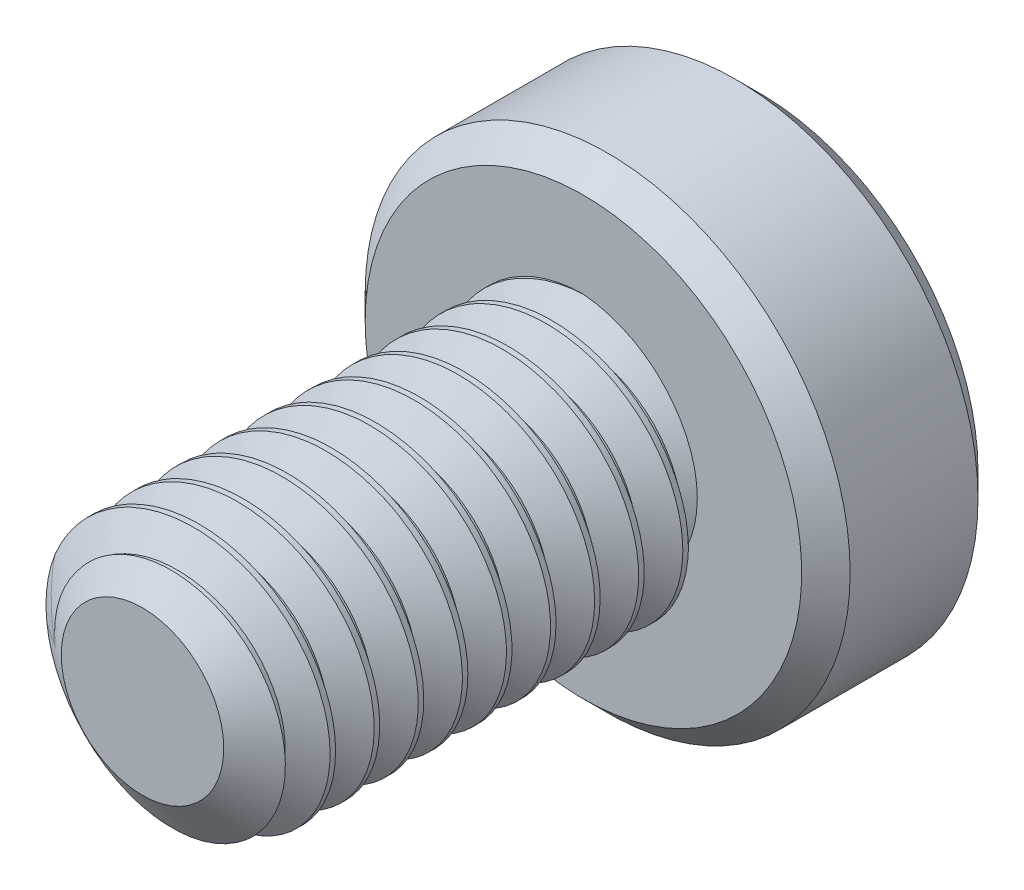
from build123d import *

# Parameters (mm, degrees)
SKETCH1_R          = 1.5
EXTRUDE1_DEPTH     = 5
CUT_SWEEP1_PITCH   = 0.5
SKETCH6_R          = 2.75
EXTRUDE2_DEPTH     = 2
CUT_EXTRUDE1_DEPTH = 1.5
CHAMFER1_SIZE      = 0.275


with BuildPart() as part:
    # Sketch1 → Extrude1 (new body)
    with BuildSketch(Plane.XY):
        Circle(SKETCH1_R)
    extrude(amount=-EXTRUDE1_DEPTH)

    # Cut-Sweep1: the profile of Sketch3 profile screwed along a right-hand helix of 11 turns, 6 arcs to a turn; built about Z, then put on its axis
    cut_sweep1_z = Axis((0, 0, 0), (0, 0, 1))
    cut_sweep1_corners = [(1.5003, 0, -0.437673205), (1.175240474, 0, -0.25), (1.175240474, 0, -0.1875), (1.5003, 0, 0.000173205)]
    with BuildLine(mode=Mode.PRIVATE) as cut_sweep1_profile:
        Line(cut_sweep1_corners[0], cut_sweep1_corners[1])
        Line(cut_sweep1_corners[1], cut_sweep1_corners[2])
        Line(cut_sweep1_corners[2], cut_sweep1_corners[3])
        Line(cut_sweep1_corners[3], cut_sweep1_corners[0])
    cut_sweep1_cap = Face(cut_sweep1_profile.wire())
    cut_sweep1_turn_angles = [0, 30, 60, 90, 120, 150, 180, 210, 240, 270, 300, 330, 360]
    cut_sweep1_turn_weights = [1, 0.8660254037844387, 1, 0.8660254037844387, 1, 0.8660254037844387, 1, 0.8660254037844387, 1, 0.8660254037844387, 1, 0.8660254037844387, 1]
    cut_sweep1_turn_rails = [Edge.make_bspline([Vector(p[0], p[1], 0).rotate(cut_sweep1_z, cut_sweep1_turn_angles[k]) / cut_sweep1_turn_weights[k] + Vector(0, 0, p[2] + CUT_SWEEP1_PITCH * cut_sweep1_turn_angles[k] / 360) for k in range(13)], [0, 0, 0, 1, 1, 2, 2, 3, 3, 4, 4, 5, 5, 6, 6, 6], 2, cut_sweep1_turn_weights) for p in cut_sweep1_corners]
    cut_sweep1_turn_sides = [Face.make_surface_from_curves(cut_sweep1_turn_rails[p[0]], cut_sweep1_turn_rails[p[1]]) for p in [(0, 1), (1, 2), (2, 3), (3, 0)]]
    cut_sweep1 = Plane(origin=(0, 0, 0), x_dir=(0, 1, 0), z_dir=(0, 0, -1)) * Solid(Shell([*[p.moved(Location((0, 0, CUT_SWEEP1_PITCH * i))) for i in range(11) for p in cut_sweep1_turn_sides], cut_sweep1_cap, cut_sweep1_cap.rotate(cut_sweep1_z, 3960).moved(Location((0, 0, CUT_SWEEP1_PITCH * 3960 / 360)))]))
    add(cut_sweep1, mode=Mode.SUBTRACT)

    # Sketch4 → Cut-Revolve1 (revolve, cut)
    with BuildSketch(Plane(origin=(0, 0, 0), x_dir=(0, 0, -1), z_dir=(1, 0, 0)), mode=Mode.PRIVATE) as cut_revolve1_sk:
        Polygon((0.405251783, 1.5), (0, 0.921240474), (0, 1.5), align=None)
    revolve(cut_revolve1_sk.sketch.rotate(Axis((0, 0, 0), (0, 0, -1)), 263.352109169), axis=Axis((0, 0, 0), (0, 0, -1)), mode=Mode.SUBTRACT)

    # Sketch6 → Extrude2 (add)
    with BuildSketch(Plane(origin=(0, 0, -5), x_dir=(-1, 0, 0), z_dir=(0, 0, -1))):
        Circle(SKETCH6_R)
    extrude(amount=EXTRUDE2_DEPTH)

    # Sketch7 → Cut-Extrude1 (cut)
    with BuildSketch(Plane(origin=(0, 0, -7), x_dir=(-1, 0, 0), z_dir=(0, 0, -1))):
        Polygon((0, 1.154700538), (-1, 0.577350269), (-1, -0.577350269), (0, -1.154700538), (1, -0.577350269), (1, 0.577350269), align=None)
    extrude(amount=-CUT_EXTRUDE1_DEPTH, mode=Mode.SUBTRACT)

    # Cut-Extrude2 cone 1 section (through the dimple's axis) → Cut-Extrude2 (revolve, cut)
    with BuildSketch(Plane(origin=(0, 0, -7), x_dir=(0, 1, 0), z_dir=(1, 0, 0))):
        Polygon((0, 0), (1.154700538, 0), (0, 1.154700538), align=None)
    revolve(axis=Axis((0, 0, -7), (0, 0, 1)), mode=Mode.SUBTRACT)

    # Chamfer1
    chamfer1_edges = [part.edges().sort_by_distance(p)[0] for p in [
        (2.75, 0, -5),
        (2.75, 0, -7),
    ]]
    chamfer(chamfer1_edges, length=CHAMFER1_SIZE)


solid = part.part
